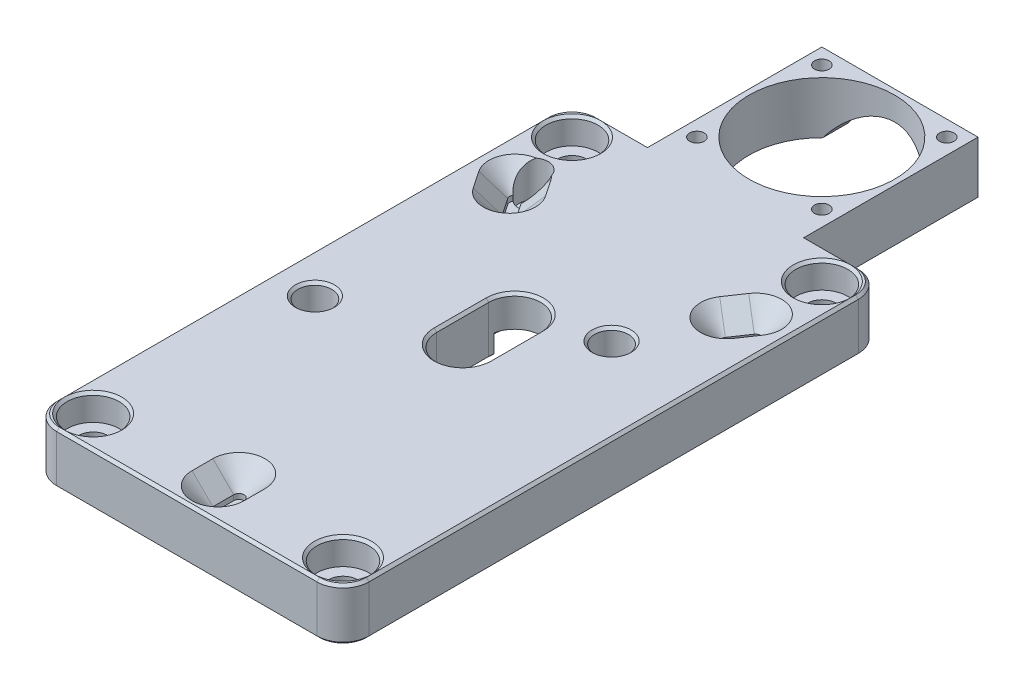
from build123d import *

# Parameters (mm, degrees)
SKETCH1_W                      = 60
SKETCH1_H                      = 104
BOSS_EXTRUDE1_DEPTH            = 10
CUT_EXTRUDE1_DEPTH             = 5
CHAMFER1_SIZE                  = 4
CUT_EXTRUDE3_START             = -1.5
SKETCH5_R                      = 15
CUT_EXTRUDE3_DEPTH             = 60.360496219
CBORE_FOR_M5_SHCS1_D           = 5.5
CBORE_FOR_M5_SHCS1_CBORE_D     = 10
CBORE_FOR_M5_SHCS1_CBORE_DEPTH = 5
FILLET1_R                      = 5
BOSS_EXTRUDE2_REACH            = 62.86
SKETCH9_R                      = 0.35
BOSS_EXTRUDE3_REACH            = 62.86
SKETCH11_R                     = 0.35
CIRPATTERN1_COUNT              = 6
CIRPATTERN2_COUNT              = 6
CUT_EXTRUDE4_DEPTH             = 61.860496219
SKETCH14_R                     = 4
CUT_EXTRUDE5_DEPTH             = 4
CUT_EXTRUDE6_REACH             = 110.701
CBORE_FOR_M3_SHCS1_D           = 3.4
CBORE_FOR_M3_SHCS1_CBORE_D     = 6.5
CBORE_FOR_M3_SHCS1_CBORE_DEPTH = 7
BOSS_EXTRUDE4_DEPTH            = 33
SKETCH23_R                     = 14
SKETCH23_R_2                   = 1.4
CUT_EXTRUDE10_DEPTH            = 91.691785736
CHAMFER2_SIZE                  = 0.5
CUT_EXTRUDE8_REACH             = 92.692
SKETCH19_R                     = 2.8
SKETCH20_R                     = 1.6
CUT_EXTRUDE9_DEPTH             = 91.41017652


with BuildPart() as part:
    # Sketch1 → Boss-Extrude1 (new body)
    with BuildSketch(Plane(origin=(0, 0, 0), x_dir=(1, 0, 0), z_dir=(0, 1, 0))):
        Rectangle(SKETCH1_W, SKETCH1_H)
    extrude(amount=BOSS_EXTRUDE1_DEPTH)

    # Sketch3 → Cut-Extrude1 (cut)
    with BuildSketch(Plane(origin=(0, 10, 0), x_dir=(1, 0, 0), z_dir=(0, 1, 0))):
        with BuildLine():
            Line((-22.293023352, 34.716785356), (-20.050757704, 31.404347468))
            ThreePointArc((-20.050757704, 31.404347468), (-20.318300764, 30.015671584), (-21.706976648, 30.283214644))
            Line((-21.706976648, 30.283214644), (-23.949242296, 33.595652532))
            ThreePointArc((-23.949242296, 33.595652532), (-23.681699236, 34.984328416), (-22.293023352, 34.716785356))
        make_face()
        with BuildLine():
            Line((23.949242296, 33.595652532), (21.706976648, 30.283214644))
            ThreePointArc((21.706976648, 30.283214644), (20.318300764, 30.015671584), (20.050757704, 31.404347468))
            Line((20.050757704, 31.404347468), (22.293023352, 34.716785356))
            ThreePointArc((22.293023352, 34.716785356), (23.681699236, 34.984328416), (23.949242296, 33.595652532))
        make_face()
        with BuildLine():
            Line((-1, -46), (-1, -42))
            ThreePointArc((-1, -42), (0, -41), (1, -42))
            Line((1, -42), (1, -46))
            ThreePointArc((1, -46), (0, -47), (-1, -46))
        make_face()
    extrude(amount=-CUT_EXTRUDE1_DEPTH, mode=Mode.SUBTRACT)

    # Chamfer1
    chamfer1_edges = [part.edges().sort_by_distance(p)[0] for p in [
        (-23.681699236, 10, -34.984328416),
        (-22.828109472, 10, -31.939433588),
        (-20.318300764, 10, -30.015671584),
        (-21.171890528, 10, -33.060566412),
        (23.681699236, 10, -34.984328416),
        (21.171890528, 10, -33.060566412),
        (20.318300764, 10, -30.015671584),
        (22.828109472, 10, -31.939433588),
        (0, 10, 47),
        (1, 10, 44),
        (0, 10, 41),
        (-1, 10, 44),
    ]]
    chamfer(chamfer1_edges, length=CHAMFER1_SIZE)

    # Sketch5 → Cut-Extrude3 (cut, through all)
    with BuildSketch(Plane(origin=(0, 10, 0), x_dir=(1, 0, 0), z_dir=(0, 1, 0)).offset(CUT_EXTRUDE3_START)):
        with Locations(Location((0, -21.5, 0), (0, 0, 270))):
            Circle(SKETCH5_R)
        with Locations(Location((0, 34, 0), (0, 0, 270))):
            Circle(SKETCH5_R)
    extrude(amount=-CUT_EXTRUDE3_DEPTH, mode=Mode.SUBTRACT)

    # CBORE for M5 SHCS1 (through all)
    with Locations(Plane(origin=(0, 10, 0), x_dir=(1, 0, 0), z_dir=(0, 1, 0))):
        with Locations((-24, 46), (24, 46), (24, -46), (-24, -46)):
            CounterBoreHole(CBORE_FOR_M5_SHCS1_D / 2, CBORE_FOR_M5_SHCS1_CBORE_D / 2, CBORE_FOR_M5_SHCS1_CBORE_DEPTH)

    # Fillet1
    fillet1_edges = [part.edges().sort_by_distance(p)[0] for p in [
        (30, 5, 52),
        (-30, 5, 52),
        (-30, 5, -52),
        (30, 5, -52),
    ]]
    fillet(fillet1_edges, radius=FILLET1_R)

    # Sketch9 → Boss-Extrude2 (add, up to next)
    with BuildSketch(Plane.XZ, mode=Mode.PRIVATE) as boss_extrude2_sk1:
        with Locations((0, -19)):
            Circle(SKETCH9_R)
    boss_extrude2_tool1 = extrude(boss_extrude2_sk1.sketch, amount=-BOSS_EXTRUDE2_REACH, mode=Mode.PRIVATE) - part.part
    boss_extrude2 = boss_extrude2_tool1.solids().sort_by_distance((0, 0, -19))[0]
    add(boss_extrude2)

    # Sketch11 → Boss-Extrude3 (add, up to next)
    with BuildSketch(Plane.XZ, mode=Mode.PRIVATE) as boss_extrude3_sk1:
        with Locations((0, 6.5)):
            Circle(SKETCH11_R)
    boss_extrude3_tool1 = extrude(boss_extrude3_sk1.sketch, amount=-BOSS_EXTRUDE3_REACH, mode=Mode.PRIVATE) - part.part
    boss_extrude3 = boss_extrude3_tool1.solids().sort_by_distance((0, 0, 6.5))[0]
    add(boss_extrude3)

    # CirPattern1: Boss-Extrude3 ×6 about axis
    cirpattern1_axis = Axis((0, 0, 21.5), (0, 1, 0))
    for i in range(1, CIRPATTERN1_COUNT):
        add(boss_extrude3.rotate(cirpattern1_axis, i * 360 / CIRPATTERN1_COUNT))

    # CirPattern2: Boss-Extrude2 ×6 about axis
    cirpattern2_axis = Axis((0, 0, -34), (0, 1, 0))
    for i in range(1, CIRPATTERN2_COUNT):
        add(boss_extrude2.rotate(cirpattern2_axis, i * 360 / CIRPATTERN2_COUNT))

    # Sketch12 → Cut-Extrude4 (cut, through all)
    with BuildSketch(Plane(origin=(0, 10, 0), x_dir=(1, 0, 0), z_dir=(0, 1, 0))):
        with BuildLine():
            Line((-5, 1), (-5, 11))
            ThreePointArc((-5, 11), (0, 16), (5, 11))
            Line((5, 11), (5, 1))
            ThreePointArc((5, 1), (0, -4), (-5, 1))
        make_face()
    extrude(amount=-CUT_EXTRUDE4_DEPTH, mode=Mode.SUBTRACT)

    # Sketch14 → Cut-Extrude5 (cut)
    with BuildSketch(Plane.XZ):
        with Locations((-4.25, -15.849)):
            Circle(SKETCH14_R)
    extrude(amount=-CUT_EXTRUDE5_DEPTH, mode=Mode.SUBTRACT)

    # Sketch15 → Cut-Extrude6 (cut, up to next)
    with BuildSketch(Plane(origin=(0, 0, -52), x_dir=(-1, 0, 0), z_dir=(0, 0, -1)), mode=Mode.PRIVATE) as cut_extrude6_sk1:
        with BuildLine():
            Line((8, 0), (-8, 0))
            ThreePointArc((-8, 0), (0, 4), (8, 0))
        make_face()
    cut_extrude6_tool1 = extrude(cut_extrude6_sk1.sketch, amount=-CUT_EXTRUDE6_REACH, mode=Mode.PRIVATE) & part.part
    add(cut_extrude6_tool1.solids().sort_by_distance((0, 1.631053, -52))[0], mode=Mode.SUBTRACT)

    # CBORE for M3 SHCS1 (through all)
    with Locations(Plane(origin=(0, 10, 0), x_dir=(1, 0, 0), z_dir=(0, 1, 0))):
        with Locations((-22.25, -5.151), (13.75, 15.849)):
            CounterBoreHole(CBORE_FOR_M3_SHCS1_D / 2, CBORE_FOR_M3_SHCS1_CBORE_D / 2, CBORE_FOR_M3_SHCS1_CBORE_DEPTH)

    # Sketch22 → Boss-Extrude4 (add)
    with BuildSketch(Plane(origin=(0, 0, -52), x_dir=(-1, 0, 0), z_dir=(0, 0, -1))):
        with BuildLine():
            Line((15, 10), (-15, 10))
            Line((-15, 10), (-15, 0))
            Line((-15, 0), (-9.810708435, 0))
            ThreePointArc((-9.810708435, 0), (0, 5.5), (9.810708435, 0))
            Line((9.810708435, 0), (15, 0))
            Line((15, 0), (15, 10))
        make_face()
    extrude(amount=BOSS_EXTRUDE4_DEPTH)

    # Sketch23 → Cut-Extrude10 (cut, through all)
    with BuildSketch(Plane.XZ):
        with Locations(Location((0, -70, 0), (0, 0, 270))):
            Circle(SKETCH23_R)
        with Locations(Location((-12, -58, 0), (0, 0, 270))):
            Circle(SKETCH23_R_2)
        with Locations(Location((12, -58, 0), (0, 0, 270))):
            Circle(SKETCH23_R_2)
        with Locations(Location((12, -82, 0), (0, 0, 270))):
            Circle(SKETCH23_R_2)
        with Locations(Location((-12, -82, 0), (0, 0, 270))):
            Circle(SKETCH23_R_2)
    extrude(amount=-CUT_EXTRUDE10_DEPTH, mode=Mode.SUBTRACT)

    # Chamfer2
    chamfer2_edges = [part.edges().sort_by_distance(p)[0] for p in [
        (-29, 10, 46),
        (19, 10, 46),
        (19, 10, -46),
        (-29, 10, -46),
        (20, 0, -52),
        (20, 10, -52),
        (30, 0, 0),
        (0, 0, 52),
        (-30, 0, 0),
        (-28.535533906, 0, -50.535533906),
        (-28.535533906, 0, 50.535533906),
        (28.535533906, 0, 50.535533906),
        (28.535533906, 0, -50.535533906),
        (30, 10, 0),
        (-30, 10, 0),
        (0, 10, 52),
        (-28.535533906, 10, -50.535533906),
        (-28.535533906, 10, 50.535533906),
        (28.535533906, 10, 50.535533906),
        (28.535533906, 10, -50.535533906),
        (0, 0, 4),
        (-5, 0, -6),
        (3.445063489, 0, -14.623746343),
        (5, 0, -6),
        (0, 10, 4),
        (5, 10, -6),
        (0, 10, -16),
        (-5, 10, -6),
        (-4.979307775, 0, -11.454416195),
        (-8.249836524, 0, -15.885163232),
        (-0.737178183, 0, -17.762134309),
        (10.5, 10, -15.849),
        (-25.5, 10, 5.151),
        (-20, 0, -52),
        (-20, 10, -52),
    ]]
    chamfer(chamfer2_edges, length=CHAMFER2_SIZE - 0.0001)  # a hair under: the kernel refuses the full size

    # Cut-Extrude8: up to this face of the body (flat: up to its plane)
    cut_extrude8_end = Plane(part.part.faces().sort_by_distance((10.591923882, 3, -15.849))[0])
    # Sketch19 → Cut-Extrude8 (cut, up to the picked face)
    with BuildSketch(Plane(origin=(0, 10, 0), x_dir=(1, 0, 0), z_dir=(0, 1, 0)), mode=Mode.PRIVATE) as cut_extrude8_sk1:
        with Locations(Location((-22.25, 36.849, 0), (0, 0, 278.016707703))):
            Circle(SKETCH19_R)
    cut_extrude8_tool1 = split(extrude(cut_extrude8_sk1.sketch, amount=-CUT_EXTRUDE8_REACH, mode=Mode.PRIVATE), bisect_by=cut_extrude8_end, keep=Keep.BOTH, mode=Mode.PRIVATE)
    add(cut_extrude8_tool1.solids().sort_by(Axis((-22.25, 10, -36.849), (0, -1, 0)))[0], mode=Mode.SUBTRACT)

    # Sketch20 → Cut-Extrude9 (cut, through all)
    with BuildSketch(Plane(origin=(0, 3, 0), x_dir=(1, 0, 0), z_dir=(0, 1, 0))):
        with Locations(Location((-22.25, 36.849, 0), (0, 0, 270))):
            Circle(SKETCH20_R)
    extrude(amount=-CUT_EXTRUDE9_DEPTH, mode=Mode.SUBTRACT)


solid = part.part
